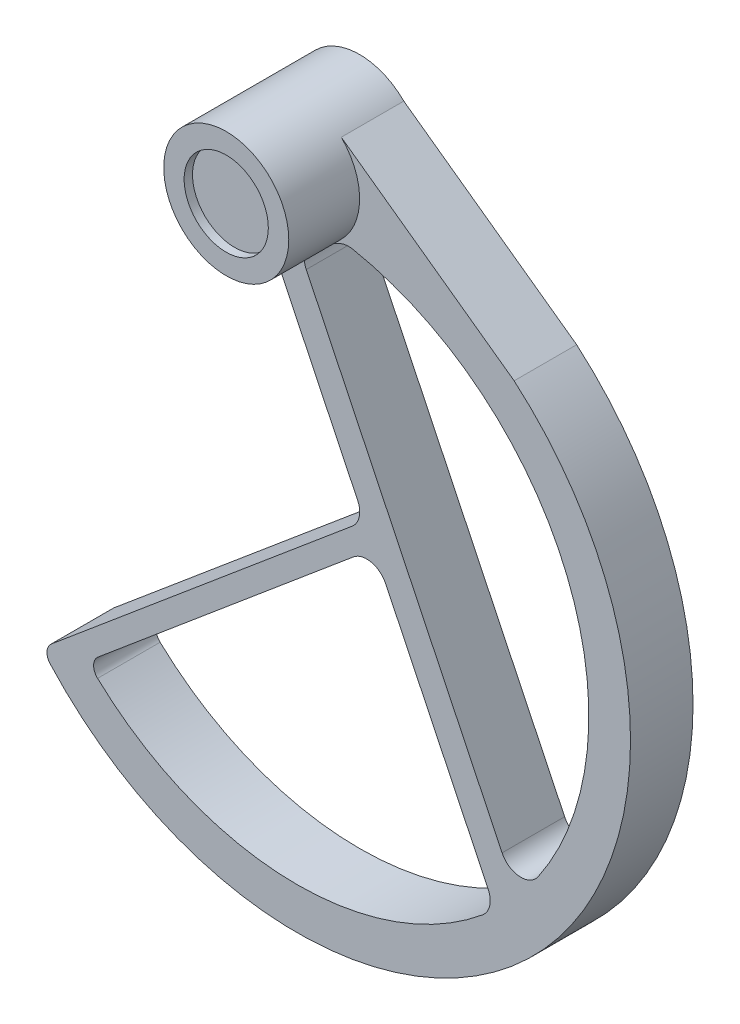
from build123d import *

# Parameters (mm, degrees)
EXTRUDE_1_DEPTH     = 15
CUT_EXTRUDE_START   = -15
CUT_EXTRUDE_1_DEPTH = 15
SKETCH_9_R          = 15
EXTRUDE_2_DEPTH     = 17
SKETCH_10_R         = 10.1
CUT_EXTRUDE_4_DEPTH = 2


with BuildPart() as part:
    # ｽｹｯﾁ4 → ﾎﾞｽ - 押し出し1 (new body)
    with BuildSketch(Plane.XY):
        with BuildLine():
            Line((13.244185189, -68.886809092), (-53.623111018, -124.995132678))
            Line((-53.623111018, -124.995132678), (-58.940636287, -129.45706617))
            ThreePointArc((-58.940636287, -129.45706617), (-60.005384698, -131.552012131), (-59.233530865, -133.771635843))
            ThreePointArc((-59.233530865, -133.771635843), (-58.595754044, -134.465930709), (-57.949839695, -135.15266158))
            ThreePointArc((-57.949839695, -135.15266158), (58.01545948, -135.083631519), (52.076178918, -19.270504783))
            Line((52.076178918, -19.270504783), (10.606601718, 10.606601718))
            ThreePointArc((10.606601718, 10.606601718), (-10.606601718, 10.606601718), (-10.606601718, -10.606601718))
            Line((-10.606601718, -10.606601718), (14.536280154, -62.889638219))
            ThreePointArc((14.536280154, -62.889638219), (14.918089499, -66.109676181), (13.244185189, -68.886809092))
        make_face()
        with BuildLine():
            ThreePointArc((13.511229465, -75.151532228), (17.77869109, -74.092739753), (21.232400696, -76.813798404))
            Line((21.232400696, -76.813798404), (45.844843506, -127.993820346))
            ThreePointArc((45.844843506, -127.993820346), (46.221944165, -131.235480845), (44.518718993, -134.019289696))
            ThreePointArc((44.518718993, -134.019289696), (-2.231208213, -149.964431749), (-47.870174388, -131.072951785))
            ThreePointArc((-47.870174388, -131.072951785), (-48.817477846, -128.802229421), (-47.747678417, -126.586582094))
            Line((-47.747678417, -126.586582094), (13.511229465, -75.151532228))
        make_face(mode=Mode.SUBTRACT)
    extrude(amount=EXTRUDE_1_DEPTH)

    # ｽｹｯﾁ6 → ｶｯﾄ - 押し出し1 (cut)
    with BuildSketch(Plane.XY.offset(15).offset(CUT_EXTRUDE_START)):
        with BuildLine():
            Line((49.189589797, -118.797265215), (2.201751786, -21.089020696))
            ThreePointArc((2.201751786, -21.089020696), (1.989274209, -17.268089629), (4.540836142, -14.416039025))
            Line((4.540836142, -14.416039025), (6.483415605, -13.48185369))
            Line((6.483415605, -13.48185369), (10.219658847, -11.685096486))
            ThreePointArc((10.219658847, -11.685096486), (11.747077013, -11.232198087), (13.339423466, -11.282754846))
            ThreePointArc((13.339423466, -11.282754846), (64.738421392, -53.37413296), (57.826055334, -119.448033215))
            ThreePointArc((57.826055334, -119.448033215), (53.319931874, -121.616182211), (49.189589797, -118.797265215))
        make_face()
    extrude(amount=CUT_EXTRUDE_1_DEPTH, mode=Mode.SUBTRACT)

    # ｽｹｯﾁ9 → ﾎﾞｽ - 押し出し2 (add)
    with BuildSketch(Plane.XY.offset(15)):
        Circle(SKETCH_9_R)
    extrude(amount=EXTRUDE_2_DEPTH)

    # ｽｹｯﾁ10 → ｶｯﾄ - 押し出し4 (cut)
    with BuildSketch(Plane.XY.offset(32)):
        Circle(SKETCH_10_R)
    extrude(amount=-CUT_EXTRUDE_4_DEPTH, mode=Mode.SUBTRACT)


solid = part.part
